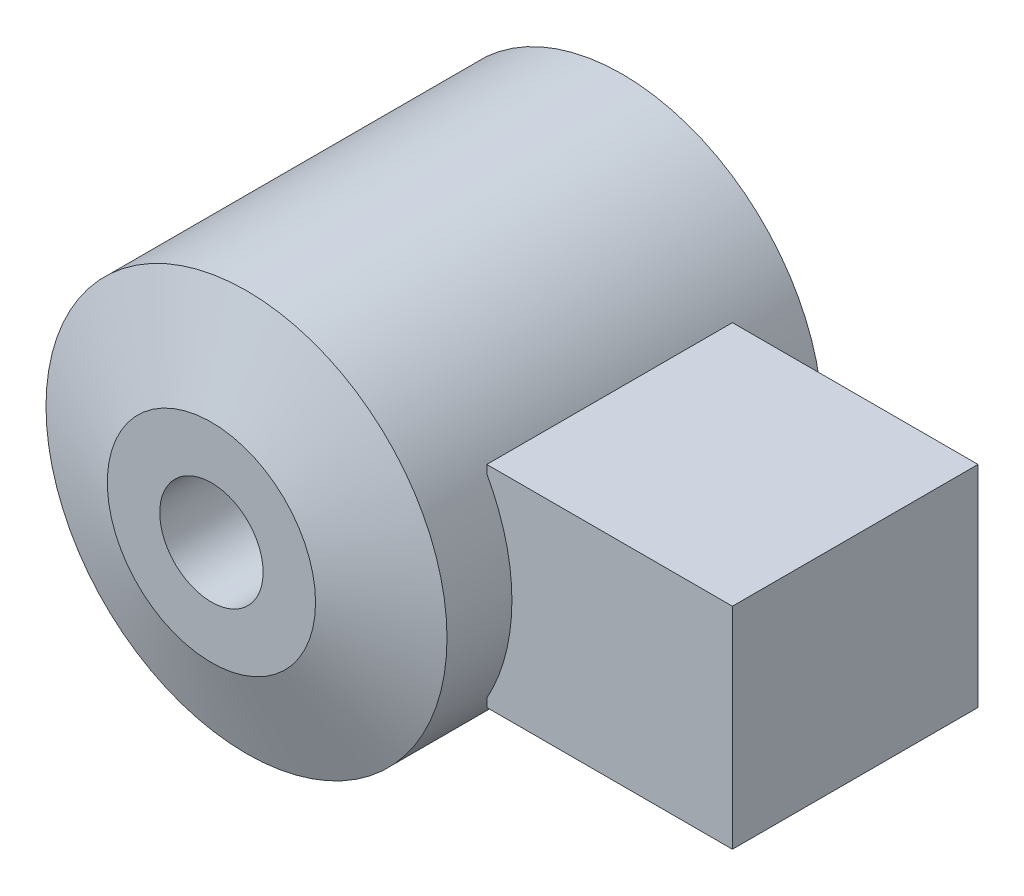
from build123d import *

# Parameters (mm, degrees)
SKETCH1_R           = 5.715
BOSS_EXTRUDE1_DEPTH = 12.7
SKETCH2_R           = 1.4732
CUT_EXTRUDE1_DEPTH  = 16.053652381
CHAMFER1_SIZE       = 1
CHAMFER1_SIZE2      = 2.747477419
CHAMFER3_SIZE       = 1
CHAMFER3_SIZE2      = 2.747477419
SKETCH3_W           = 7
SKETCH3_H           = 6
BOSS_EXTRUDE2_DEPTH = 7


with BuildPart() as part:
    # Sketch1 → Boss-Extrude1 (new body)
    with BuildSketch(Plane.XY):
        Circle(SKETCH1_R)
    extrude(amount=BOSS_EXTRUDE1_DEPTH)

    # Sketch2 → Cut-Extrude1 (cut, through all)
    with BuildSketch(Plane.XY.offset(12.7)):
        Circle(SKETCH2_R)
    extrude(amount=-CUT_EXTRUDE1_DEPTH, mode=Mode.SUBTRACT)

    # Chamfer1
    chamfer1_edges = [part.edges().sort_by_distance(p)[0] for p in [
        (-5.715, 0, 12.7),
    ]]
    chamfer1_side = [part.faces().sort_by_distance(p)[0] for p in [
        (-5.715, 0, 6.35),
    ]]
    chamfer(chamfer1_edges, length=CHAMFER1_SIZE, length2=CHAMFER1_SIZE2, reference=chamfer1_side[0])

    # Chamfer3
    chamfer3_edges = [part.edges().sort_by_distance(p)[0] for p in [
        (-5.715, 0, 0),
    ]]
    chamfer3_side = [part.faces().sort_by_distance(p)[0] for p in [
        (-5.715, 0, 5.85),
    ]]
    chamfer(chamfer3_edges, length=CHAMFER3_SIZE, length2=CHAMFER3_SIZE2, reference=chamfer3_side[0])

    # Sketch3 → Boss-Extrude2 (add)
    with BuildSketch(Plane(origin=(5, 0, 0), x_dir=(0, 0, -1), z_dir=(1, 0, 0))):
        with Locations((-6.35, 0)):
            Rectangle(SKETCH3_W, SKETCH3_H)
    extrude(amount=BOSS_EXTRUDE2_DEPTH)


solid = part.part
